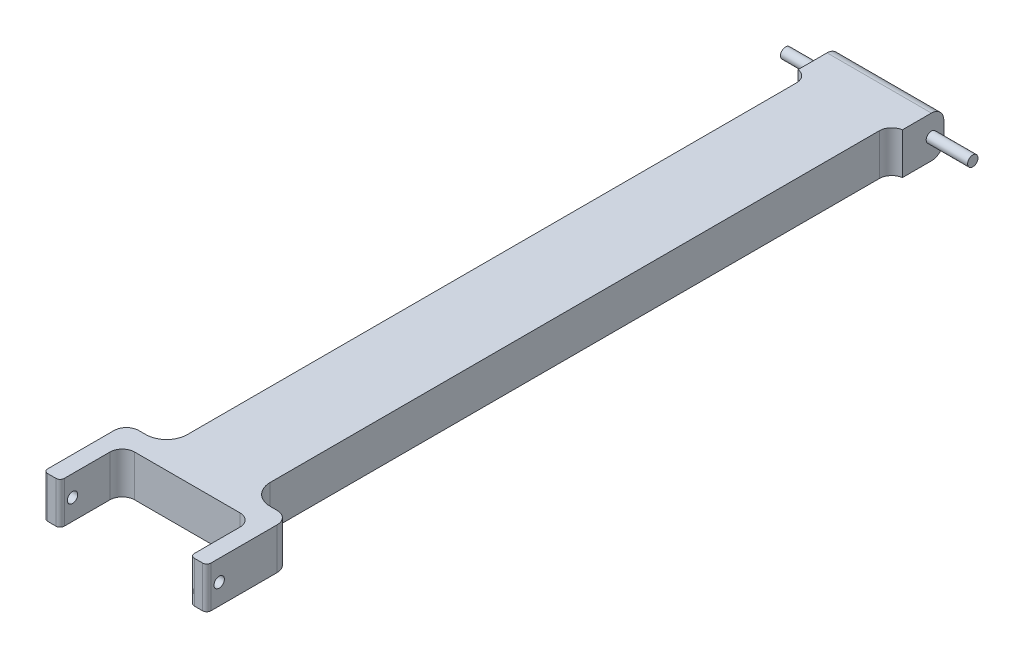
from build123d import *

# Parameters (mm, degrees)
SKETCH1_W               = 39.39
SKETCH1_H               = 10
BOSS_EXTRUDE1_DEPTH     = 20
SKETCH2_W               = 31.39
SKETCH2_H               = 10
CUT_EXTRUDE1_DEPTH      = 15
CUT_EXTRUDE2_DEPTH      = 46.294283304
CUT_EXTRUDE2_DEPTH_BACK = 46.294283304
SKETCH3_R               = 1.25
FILLET1_R               = 3
FILLET3_R               = 1
SKETCH4_W               = 20
SKETCH4_H               = 10
BOSS_EXTRUDE2_DEPTH     = 165
FILLET4_R               = 5
SKETCH7_W               = 10
SKETCH7_H               = 10
BOSS_EXTRUDE5_DEPTH     = 2.59
SKETCH8_W               = 10
SKETCH8_H               = 10
BOSS_EXTRUDE6_DEPTH     = 2.59
FILLET7_R               = 3
FILLET11_R              = 3
SKETCH9_R               = 1.25
BOSS_EXTRUDE7_DEPTH     = 10
BOSS_EXTRUDE8_START     = 10
SKETCH10_R              = 1.25
BOSS_EXTRUDE8_DEPTH     = 10


with BuildPart() as part:
    # Sketch1 → Boss-Extrude1 (new body)
    with BuildSketch(Plane.XY):
        with Locations((19.695, 5)):
            Rectangle(SKETCH1_W, SKETCH1_H)
    extrude(amount=BOSS_EXTRUDE1_DEPTH)

    # Sketch2 → Cut-Extrude1 (cut)
    with BuildSketch(Plane.XY.offset(20)):
        with Locations((19.695, 5)):
            Rectangle(SKETCH2_W, SKETCH2_H)
    extrude(amount=-CUT_EXTRUDE1_DEPTH, mode=Mode.SUBTRACT)

    # Sketch3 → Cut-Extrude2 (cut, two sides: drawn at the far end of the back side and taken through both)
    with BuildSketch(Plane.ZY.offset(-CUT_EXTRUDE2_DEPTH_BACK)):
        with Locations(Location((17, 5, 0), (0, 0, 270))):
            Circle(SKETCH3_R)
    extrude(amount=CUT_EXTRUDE2_DEPTH + CUT_EXTRUDE2_DEPTH_BACK, mode=Mode.SUBTRACT)

    # Fillet1
    fillet1_edges = [part.edges().sort_by_distance(p)[0] for p in [
        (4, 5, 5),
        (35.39, 5, 5),
        (39.39, 5, 0),
        (0, 5, 0),
    ]]
    fillet(fillet1_edges, radius=FILLET1_R)

    # Fillet3
    fillet3_edges = [part.edges().sort_by_distance(p)[0] for p in [
        (39.39, 5, 20),
        (4, 5, 20),
        (35.39, 5, 20),
        (0, 5, 20),
    ]]
    fillet(fillet3_edges, radius=FILLET3_R)

    # Sketch4 → Boss-Extrude2 (add)
    with BuildSketch(Plane(origin=(0, 0, 0), x_dir=(-1, 0, 0), z_dir=(0, 0, -1))):
        with Locations((-19.695, 5)):
            Rectangle(SKETCH4_W, SKETCH4_H)
    extrude(amount=BOSS_EXTRUDE2_DEPTH)

    # Fillet4
    fillet4_edges = [part.edges().sort_by_distance(p)[0] for p in [
        (29.695, 5, 0),
        (9.695, 5, 0),
    ]]
    fillet(fillet4_edges, radius=FILLET4_R)

    # Sketch7 → Boss-Extrude5 (add)
    with BuildSketch(Plane.ZY.offset(-9.695)):
        with Locations((-160, 5)):
            Rectangle(SKETCH7_W, SKETCH7_H)
    extrude(amount=BOSS_EXTRUDE5_DEPTH)

    # Sketch8 → Boss-Extrude6 (add)
    with BuildSketch(Plane(origin=(29.695, 0, 0), x_dir=(0, 0, -1), z_dir=(1, 0, 0))):
        with Locations((160, 5)):
            Rectangle(SKETCH8_W, SKETCH8_H)
    extrude(amount=BOSS_EXTRUDE6_DEPTH)

    # Fillet7
    # the kernel refuses this fillet: 3 mm, written as the material it adds along each edge
    with BuildSketch(Plane(origin=(9.695, 0, -155), x_dir=(0, 0, 1), z_dir=(0, 1, 0))) as fillet7_piece_1:
        with BuildLine():
            CenterArc((2.971851275, -3), FILLET7_R, 90, 82.144993797)
            Line((0, -2.59), (-0.059437025, -2.5818))
            ThreePointArc((-0.059437025, -2.5818), (-0.06, -1.295), (-0.06, 0))
            Line((-0.06, 0), (0, 0.06))
            Line((0, 0.06), (2.971851275, 0.06))
            Line((2.971851275, 0.06), (2.971851275, 0))
        make_face()
    extrude(amount=10)
    with BuildSketch(Plane(origin=(29.695, 10, -155), x_dir=(1, 0, 0), z_dir=(0, -1, 0))) as fillet7_piece_2:
        with BuildLine():
            CenterArc((3, 2.971851275), FILLET7_R, 180, 82.144993797)
            Line((0, 2.971851275), (-0.06, 2.971851275))
            Line((-0.06, 2.971851275), (-0.06, 0))
            Line((-0.06, 0), (0, -0.06))
            ThreePointArc((0, -0.06), (1.295, -0.06), (2.5818, -0.059437025))
            Line((2.5818, -0.059437025), (2.59, 0))
        make_face()
    extrude(amount=10)

    # Fillet11
    fillet11_edges = [part.edges().sort_by_distance(p)[0] for p in [
        (19.695, 0, -165),
        (19.695, 10, -165),
    ]]
    fillet(fillet11_edges, radius=FILLET11_R)

    # Sketch9 → Boss-Extrude7 (add)
    with BuildSketch(Plane.ZY.offset(-7.105)):
        with Locations(Location((-162, 5, 0), (0, 0, 180))):
            Circle(SKETCH9_R)
    extrude(amount=BOSS_EXTRUDE7_DEPTH)

    # Sketch10 → Boss-Extrude8 (add)
    with BuildSketch(Plane(origin=(32.285, 0, 0), x_dir=(0, 0, -1), z_dir=(1, 0, 0)).offset(BOSS_EXTRUDE8_START)):
        with Locations((162, 5)):
            Circle(SKETCH10_R)
    extrude(amount=-BOSS_EXTRUDE8_DEPTH)


solid = part.part
